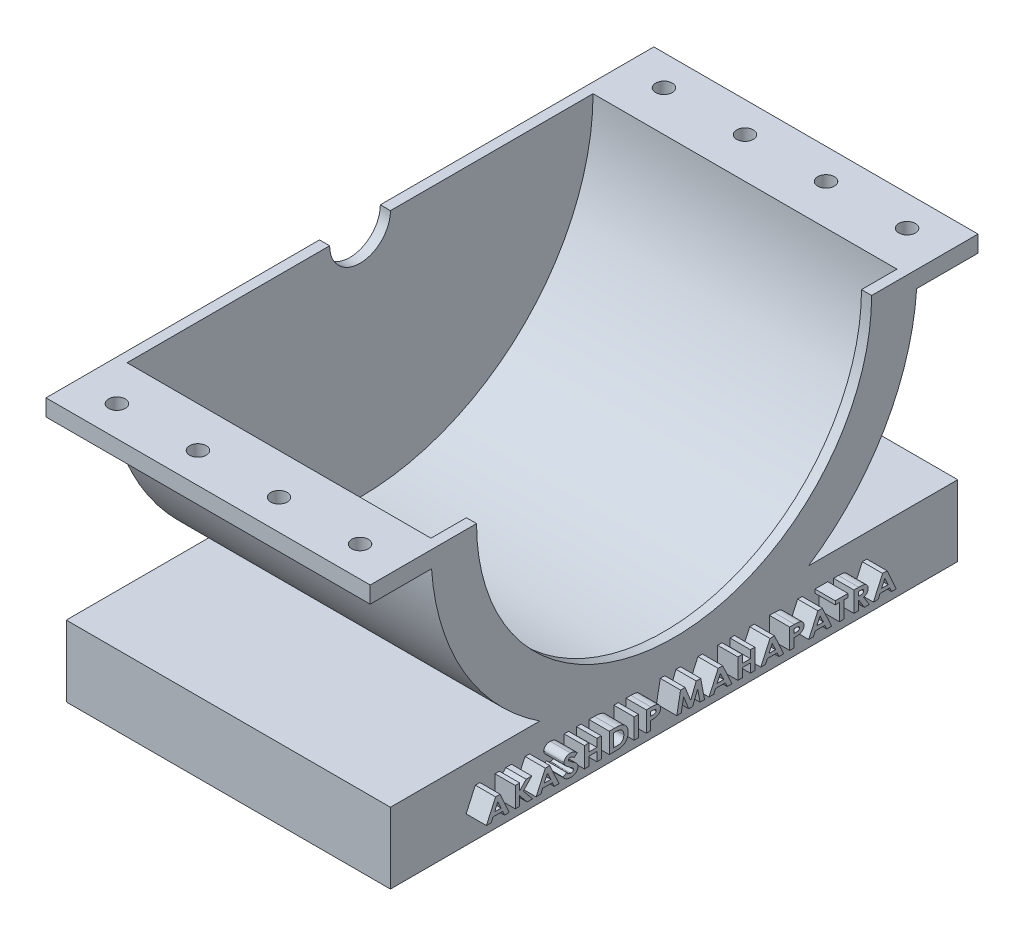
from build123d import *

# Parameters (mm, degrees)
BOSS_EXTRUDE1_DEPTH  = 4
SKETCH2_R            = 5.75
CUT_EXTRUDE1_DEPTH   = 3.75
SKETCH5_R            = 0.205
CUT_EXTRUDE2_DEPTH   = 0.41
LPATTERN1_COUNT      = 4
LPATTERN1_PITCH      = 2
LPATTERN1_COUNT_DIR2 = 2
LPATTERN1_PITCH_DIR2 = 13.5
CUT_EXTRUDE3_DEPTH   = 13.440483311
CUT_EXTRUDE4_REACH   = 14.44
SKETCH6_3_R          = 4.875
SKETCH6_3_R_2        = 0.75
SCALE1_SCALE         = 25.4
WRAP1_OUTLINE_W      = 2.767948718
WRAP1_OUTLINE_H      = 12.7
WRAP1_DEPTH          = 12.7


# Read off the part's stored shape, not the designer's step: Wrap1
with BuildPart() as part:
    # Sketch1 → Boss-Extrude1 (new, symmetric)
    with BuildSketch(Plane(origin=(0, 0, 0), x_dir=(0, 0, -1), z_dir=(1, 0, 0))):
        with BuildLine():
            Line((-7, 0.875), (-7, -0.875))
            Line((-7, -0.875), (7, -0.875))
            Line((7, -0.875), (7, 0.875))
            Line((7, 0.875), (3.31662479, 0.875))
            ThreePointArc((3.31662479, 0.875), (5.186676874, 2.858647401), (5.985975276, 5.465))
            Line((5.985975276, 5.465), (7.5, 5.465))
            Line((7.5, 5.465), (7.5, 5.875))
            Line((7.5, 5.875), (-7.5, 5.875))
            Line((-7.5, 5.875), (-7.5, 5.465))
            Line((-7.5, 5.465), (-5.985975276, 5.465))
            ThreePointArc((-5.985975276, 5.465), (-5.186676874, 2.858647401), (-3.31662479, 0.875))
            Line((-3.31662479, 0.875), (-7, 0.875))
        make_face()
    extrude(amount=BOSS_EXTRUDE1_DEPTH, both=True)

    # Sketch2 → Cut-Extrude1 (cut, symmetric)
    with BuildSketch(Plane(origin=(0, 0, 0), x_dir=(0, 0, -1), z_dir=(1, 0, 0))):
        with Locations((0, 5.875)):
            Circle(SKETCH2_R)
    extrude(amount=CUT_EXTRUDE1_DEPTH, both=True, mode=Mode.SUBTRACT)

    # Sketch5 → Cut-Extrude2 (cut)
    with BuildSketch(Plane(origin=(0, 5.875, 0), x_dir=(1, 0, 0), z_dir=(0, 1, 0))):
        with Locations(Location((-3, 6.75, 0), (0, 0, 270))):
            Circle(SKETCH5_R)
    cut_extrude2 = extrude(amount=-CUT_EXTRUDE2_DEPTH, mode=Mode.SUBTRACT)

    # LPattern1: Cut-Extrude2 4 × 2
    with Locations(*[(i * LPATTERN1_PITCH, 0, j * LPATTERN1_PITCH_DIR2) for i in range(LPATTERN1_COUNT) for j in range(LPATTERN1_COUNT_DIR2) if (i, j) != (0, 0)]):
        add(cut_extrude2, mode=Mode.SUBTRACT)

    # Sketch6 → Cut-Extrude3 (cut, through all)
    with BuildSketch(Plane(origin=(4, 0, 0), x_dir=(0, 0, -1), z_dir=(1, 0, 0))):
        with BuildLine():
            Line((-0.75, 5.875), (0.75, 5.875))
            ThreePointArc((0.75, 5.875), (0, 6.625), (-0.75, 5.875))
        make_face()
        with BuildLine():
            ThreePointArc((-0.75, 5.875), (0, 5.125), (0.75, 5.875))
            Line((0.75, 5.875), (-0.75, 5.875))
        make_face()
    extrude(amount=-CUT_EXTRUDE3_DEPTH, mode=Mode.SUBTRACT)

    # Sketch6<3> → Cut-Extrude4 (cut, up to next)
    with BuildSketch(Plane(origin=(4, 0, 0), x_dir=(0, 0, -1), z_dir=(1, 0, 0)), mode=Mode.PRIVATE) as cut_extrude4_sk1:
        with Locations((0, 5.875)):
            Circle(SKETCH6_3_R)
        with Locations((0, 5.875)):
            Circle(SKETCH6_3_R_2, mode=Mode.SUBTRACT)
    cut_extrude4_tool1 = extrude(cut_extrude4_sk1.sketch, amount=-CUT_EXTRUDE4_REACH, mode=Mode.PRIVATE) & part.part
    add(cut_extrude4_tool1.solids().sort_by_distance((4, 5.875, 4.737114))[0], mode=Mode.SUBTRACT)


with BuildPart() as part_1:
    # Scale1: scaled about (-0.158509588, 0.753010739, 0)
    add(part.part.scale(SCALE1_SCALE).moved(Location((3.867633947, -18.373462032, 0))))

    # Wrap1 outline → Wrap1 (add)
    # profile 1 of 17: a face of its own
    with BuildSketch(Plane(origin=(105.467633957, 0, 0), x_dir=(0, 0, -1), z_dir=(1, 0, 0))):
        with BuildLine():
            add(Edge.make_bspline(
                [(-75.386269734, -14.026275972), (-75.477958966, -13.922997687), (-75.655322175, -13.723216671), (-75.938888284, -13.457776604), (-76.223804813, -13.232635163), (-76.509602736, -13.047676728), (-76.796542554, -12.902535229), (-77.086206781, -12.799967333), (-77.378004048, -12.735753275), (-77.573858995, -12.727699864), (-77.670845054, -12.723711869)],
                knots=[0, 0, 0, 0, 0.152659398, 0.295303603, 0.428877079, 0.553739135, 0.671167669, 0.783579981, 0.892830255, 1, 1, 1, 1], degree=3))
            Line((-75.386269734, -14.026275972), (-73.256882714, -12.466760747))
            add(Edge.make_bspline(
                [(-77.597067009, -10.44422469), (-77.411895376, -10.449701146), (-77.044001247, -10.460581624), (-76.500185136, -10.544909617), (-75.969612247, -10.679463744), (-75.539167174, -10.839899429), (-75.19725817, -10.99820228), (-74.934878823, -11.141306106), (-74.668254416, -11.308586959), (-74.392257774, -11.492408138), (-74.116455115, -11.70569349), (-73.833006009, -11.938011206), (-73.542963935, -12.190946019), (-73.353627995, -12.373487329), (-73.256882714, -12.466760747)],
                knots=[0, 0, 0, 0, 0.112750237, 0.224009204, 0.33438332, 0.445685447, 0.503228736, 0.563788081, 0.627576777, 0.694912236, 0.765680889, 0.839822751, 0.918153981, 1, 1, 1, 1], degree=3))
            add(Edge.make_bspline(
                [(-81.723549381, -13.665017959), (-81.720427531, -13.556220905), (-81.714262719, -13.341375997), (-81.65593126, -13.025130729), (-81.561545953, -12.721251525), (-81.430545667, -12.429345087), (-81.263524687, -12.148462446), (-81.055779926, -11.882095815), (-80.812601987, -11.62684776), (-80.536423056, -11.387002357), (-80.232930968, -11.166675206), (-79.907514152, -10.973518281), (-79.564044442, -10.810086613), (-79.204397231, -10.674377148), (-78.82701403, -10.570590758), (-78.432237905, -10.496539819), (-78.020347233, -10.453415953), (-77.739635392, -10.447320472), (-77.597067009, -10.44422469)],
                knots=[0, 0, 0, 0, 0.056170461, 0.110921546, 0.165526908, 0.220249932, 0.275858717, 0.333966338, 0.394404589, 0.457760192, 0.522706535, 0.587934591, 0.653003504, 0.719006979, 0.786299609, 0.854964891, 0.926339335, 1, 1, 1, 1], degree=3))
            add(Edge.make_bspline(
                [(-77.777696016, -18.122229497), (-77.976611488, -17.985533848), (-78.357846721, -17.723547203), (-78.89827269, -17.336123962), (-79.38455412, -16.973660141), (-79.814568319, -16.633282062), (-80.189330383, -16.317404276), (-80.51177837, -16.02892824), (-80.777243778, -15.762563811), (-80.992840257, -15.515427718), (-81.165477966, -15.278350516), (-81.315657691, -15.048611128), (-81.439652642, -14.817461614), (-81.542524937, -14.586203797), (-81.625247558, -14.356275258), (-81.679886216, -14.124806472), (-81.71900626, -13.895315471), (-81.722040554, -13.741502629), (-81.723549381, -13.665017959)],
                knots=[0, 0, 0, 0, 0.11724404, 0.224706294, 0.32299845, 0.411847771, 0.491072557, 0.561070729, 0.621952114, 0.673650235, 0.720202811, 0.764310708, 0.806887658, 0.847460379, 0.88719842, 0.925365868, 0.962887579, 1, 1, 1, 1], degree=3))
            add(Edge.make_bspline(
                [(-75.699190407, -20.312674209), (-75.703354644, -20.239947544), (-75.711894351, -20.090805118), (-75.793163962, -19.87166074), (-75.914381887, -19.652691559), (-76.055369213, -19.474203428), (-76.199095043, -19.324225403), (-76.339889288, -19.195995695), (-76.507368941, -19.050130394), (-76.70699686, -18.893871689), (-76.933426716, -18.720873057), (-77.187600454, -18.531866628), (-77.473219247, -18.332108856), (-77.67330523, -18.194187273), (-77.777696016, -18.122229497)],
                knots=[0, 0, 0, 0, 0.069656103, 0.142845548, 0.221998529, 0.309697071, 0.360419396, 0.421544443, 0.492611602, 0.573810517, 0.665086112, 0.766465276, 0.878158015, 1, 1, 1, 1], degree=3))
            add(Edge.make_bspline(
                [(-77.446966849, -21.516019561), (-77.327849779, -21.512056206), (-77.097658433, -21.504397101), (-76.768556529, -21.43331912), (-76.466802636, -21.322335557), (-76.204509925, -21.162120013), (-75.982269072, -20.978749716), (-75.819616995, -20.772152702), (-75.715987542, -20.548050441), (-75.704770888, -20.390872815), (-75.699190407, -20.312674209)],
                knots=[0, 0, 0, 0, 0.152897008, 0.2954704, 0.430684796, 0.564139584, 0.688618973, 0.798927781, 0.899963069, 1, 1, 1, 1], degree=3))
            add(Edge.make_bspline(
                [(-79.957964445, -19.887814433), (-79.868001098, -20.016915275), (-79.694147228, -20.266402221), (-79.402283141, -20.596917403), (-79.10439283, -20.880492532), (-78.794541165, -21.113000666), (-78.472496733, -21.29238793), (-78.139925973, -21.422063803), (-77.79667879, -21.501307279), (-77.563550885, -21.511114904), (-77.446966849, -21.516019561)],
                knots=[0, 0, 0, 0, 0.151131279, 0.292060695, 0.42295247, 0.545866055, 0.663349338, 0.776115142, 0.888038283, 1, 1, 1, 1], degree=3))
            Line((-79.957964445, -19.887814433), (-82.374831432, -21.091159786))
            add(Edge.make_bspline(
                [(-77.541097458, -23.795506741), (-77.672601773, -23.793613133), (-77.931732427, -23.789881757), (-78.313961292, -23.758544787), (-78.683524228, -23.708127514), (-79.040443197, -23.636983029), (-79.384607654, -23.545306941), (-79.715612376, -23.434040554), (-80.032938756, -23.300111251), (-80.339264686, -23.148402384), (-80.632818733, -22.971207151), (-80.915767272, -22.773151354), (-81.185989811, -22.55005019), (-81.446969881, -22.305305632), (-81.694748026, -22.034879328), (-81.935552394, -21.743777797), (-82.164798787, -21.428921554), (-82.304130315, -21.204857037), (-82.374831432, -21.091159786)],
                knots=[0, 0, 0, 0, 0.067695667, 0.133395033, 0.197301531, 0.25963615, 0.320636965, 0.38055795, 0.43926413, 0.497840285, 0.556393655, 0.615625126, 0.675496782, 0.736652083, 0.799680074, 0.864190716, 0.931086178, 1, 1, 1, 1], degree=3))
            add(Edge.make_bspline(
                [(-72.931241689, -20.180382542), (-72.935296181, -20.308632126), (-72.943260735, -20.560562729), (-73.001962933, -20.930953613), (-73.105312303, -21.281596537), (-73.242456406, -21.618048141), (-73.426319009, -21.933667476), (-73.644557169, -22.236125135), (-73.908358125, -22.516974647), (-74.206354743, -22.779545658), (-74.53684736, -23.018193952), (-74.894139494, -23.227981909), (-75.276538291, -23.402680248), (-75.682653513, -23.546434794), (-76.112776384, -23.657089667), (-76.567564073, -23.738751719), (-77.046468246, -23.787688217), (-77.373921347, -23.792864215), (-77.541097458, -23.795506741)],
                knots=[0, 0, 0, 0, 0.058731266, 0.115370381, 0.171176354, 0.225851727, 0.281350033, 0.338062346, 0.396328134, 0.45742003, 0.519729533, 0.58274682, 0.646875847, 0.711984232, 0.779812749, 0.850056995, 0.92344892, 1, 1, 1, 1], degree=3))
            add(Edge.make_bspline(
                [(-74.551814605, -17.267421805), (-74.413346394, -17.388308652), (-74.149222622, -17.618896523), (-73.802479453, -17.980290884), (-73.517612167, -18.332597898), (-73.29604915, -18.683237142), (-73.133853867, -19.039460413), (-73.013510328, -19.40469594), (-72.944451288, -19.787673078), (-72.935672001, -20.04867337), (-72.931241689, -20.180382542)],
                knots=[0, 0, 0, 0, 0.159565823, 0.304366804, 0.434332212, 0.552441623, 0.663491149, 0.773416579, 0.885658692, 1, 1, 1, 1], degree=3))
            add(Edge.make_bspline(
                [(-76.566718452, -15.80203719), (-76.435311804, -15.894522925), (-76.185962607, -16.070018186), (-75.831165047, -16.318544551), (-75.519281632, -16.544206747), (-75.243905863, -16.73660319), (-75.015127473, -16.909952775), (-74.823424941, -17.05095058), (-74.673591696, -17.167568583), (-74.588172993, -17.237609119), (-74.551814605, -17.267421805)],
                knots=[0, 0, 0, 0, 0.193455233, 0.367088787, 0.521492782, 0.656907828, 0.771457166, 0.867016653, 0.943395768, 1, 1, 1, 1], degree=3))
            add(Edge.make_bspline(
                [(-78.696105471, -14.163655779), (-78.660168899, -14.200683976), (-78.576478324, -14.286916771), (-78.417522187, -14.419659867), (-78.218741161, -14.584958724), (-77.972812781, -14.774600526), (-77.686073754, -14.994680449), (-77.350881273, -15.236908084), (-76.975991323, -15.513396416), (-76.70786711, -15.702491725), (-76.566718452, -15.80203719)],
                knots=[0, 0, 0, 0, 0.057529563, 0.133977227, 0.230759984, 0.346009525, 0.480349956, 0.633995626, 0.807324277, 1, 1, 1, 1], degree=3))
            add(Edge.make_bspline(
                [(-78.955600663, -13.555622927), (-78.953086361, -13.608679827), (-78.947980848, -13.716416576), (-78.891570659, -13.871867187), (-78.813844932, -14.026920134), (-78.736458449, -14.116792217), (-78.696105471, -14.163655779)],
                knots=[0, 0, 0, 0, 0.234387218, 0.475944074, 0.726732412, 1, 1, 1, 1], degree=3))
            add(Edge.make_bspline(
                [(-77.670845054, -12.723711869), (-77.760966916, -12.726189334), (-77.934158817, -12.730950408), (-78.181525112, -12.779785926), (-78.403214249, -12.861409504), (-78.595658173, -12.972241661), (-78.751599082, -13.1022864), (-78.870769836, -13.24196979), (-78.940930979, -13.396201448), (-78.950784052, -13.503278836), (-78.955600663, -13.555622927)],
                knots=[0, 0, 0, 0, 0.160784811, 0.308988589, 0.447952035, 0.580944808, 0.70349073, 0.808979184, 0.906620706, 1, 1, 1, 1], degree=3))
        make_face()
    # profile 2 of 17: a face of its own
    with BuildSketch(Plane(origin=(105.467633957, 0, 0), x_dir=(0, 0, -1), z_dir=(1, 0, 0))):
        with BuildLine():
            add(Edge.make_bspline(
                [(-49.946582234, -10.769865715), (-49.682806834, -10.771430813), (-49.172840587, -10.774456672), (-48.433852577, -10.808558673), (-47.747323602, -10.860812724), (-47.112950483, -10.93297731), (-46.531049206, -11.028761459), (-46.001746173, -11.147515563), (-45.524346976, -11.285993773), (-45.093615202, -11.448079549), (-44.699733476, -11.637727781), (-44.326264267, -11.848541594), (-43.972571785, -12.088955749), (-43.635051934, -12.354074137), (-43.316146811, -12.64761111), (-43.016438367, -12.969945876), (-42.730642022, -13.315121772), (-42.466837532, -13.687003331), (-42.225276687, -14.078258623), (-42.016158325, -14.490486279), (-41.837688121, -14.917976139), (-41.691849806, -15.362783831), (-41.581031361, -15.824221481), (-41.49926562, -16.30085845), (-41.449651722, -16.794013624), (-41.444414194, -17.128230816), (-41.441754509, -17.297950651)],
                knots=[0, 0, 0, 0, 0.064682562, 0.125053069, 0.181373286, 0.233506669, 0.281576806, 0.32592416, 0.366460862, 0.403385688, 0.438640563, 0.473566974, 0.508463652, 0.543411727, 0.578735234, 0.614635613, 0.651275301, 0.688553917, 0.726361302, 0.763936324, 0.801786011, 0.839864113, 0.878602084, 0.918056892, 0.958388225, 1, 1, 1, 1], degree=3))
            Line((-49.946582234, -10.769865715), (-53.327651945, -10.769865715))
            Line((-53.327651945, -10.769865715), (-53.327651945, -23.469865715))
            Line((-53.327651945, -23.469865715), (-49.895700823, -23.469865715))
            add(Edge.make_bspline(
                [(-41.441754509, -17.297950651), (-41.44414517, -17.419248103), (-41.448864716, -17.65870858), (-41.473330769, -18.014806051), (-41.52087465, -18.362510743), (-41.579981039, -18.704583482), (-41.662466895, -19.038077534), (-41.762121029, -19.364919159), (-41.878186044, -19.68475147), (-42.058185167, -20.097010972), (-42.318649185, -20.586073046), (-42.689094021, -21.127665826), (-43.117562548, -21.61490819), (-43.597462129, -22.044353157), (-44.113597305, -22.417650012), (-44.65422723, -22.73271191), (-45.217095327, -22.983825249), (-45.711232885, -23.141850467), (-46.140936139, -23.240788632), (-46.518806719, -23.29847258), (-46.948775549, -23.352692369), (-47.433488605, -23.393760688), (-47.971943737, -23.430819176), (-48.56504313, -23.450865071), (-49.212098917, -23.467579334), (-49.661632458, -23.469082848), (-49.895700823, -23.469865715)],
                knots=[0, 0, 0, 0, 0.030361655, 0.05993874, 0.089264998, 0.118157205, 0.14677764, 0.175176881, 0.203645034, 0.231875647, 0.287706288, 0.342042914, 0.395730297, 0.449682155, 0.502876029, 0.554894698, 0.606009719, 0.656819361, 0.684467156, 0.716288442, 0.75243222, 0.792918197, 0.838010285, 0.88749821, 0.941421256, 1, 1, 1, 1], degree=3))
        make_face()
        with BuildLine():
            add(Edge.make_bspline(
                [(-49.196081432, -21.190378536), (-49.03406944, -21.190090188), (-48.720928322, -21.189532861), (-48.26901234, -21.165926662), (-47.851044597, -21.142080794), (-47.468733644, -21.096412915), (-47.119630077, -21.046875243), (-46.80657349, -20.97522992), (-46.524902055, -20.903223784), (-46.276674367, -20.808605428), (-46.050145598, -20.702747209), (-45.838987688, -20.579822898), (-45.636546327, -20.441386091), (-45.443741188, -20.288076336), (-45.265192007, -20.11439847), (-45.093383287, -19.929071145), (-44.933229254, -19.724484864), (-44.784089407, -19.504593341), (-44.647866021, -19.269952741), (-44.53216796, -19.020752519), (-44.431548488, -18.759271972), (-44.350810763, -18.484303032), (-44.287452697, -18.196113853), (-44.240875279, -17.894563368), (-44.216825194, -17.579886363), (-44.212100049, -17.365826856), (-44.209703227, -17.257245523)],
                knots=[0, 0, 0, 0, 0.066379239, 0.128299571, 0.185420288, 0.237881429, 0.286047228, 0.329809444, 0.36943239, 0.40506255, 0.43848559, 0.471805493, 0.505060091, 0.538926434, 0.572599663, 0.607033594, 0.642420576, 0.678951128, 0.71584845, 0.753470192, 0.791419537, 0.83056412, 0.870783025, 0.912264295, 0.955496208, 1, 1, 1, 1], degree=3))
            Line((-49.196081432, -21.190378536), (-50.559703227, -21.190378536))
            Line((-50.559703227, -21.190378536), (-50.559703227, -13.049352895))
            Line((-50.559703227, -13.049352895), (-49.562427586, -13.049352895))
            add(Edge.make_bspline(
                [(-45.583501304, -14.0669811), (-45.692595483, -13.984227943), (-45.916438818, -13.814432057), (-46.302233757, -13.610875276), (-46.7305958, -13.434949659), (-47.207559831, -13.294170755), (-47.729705326, -13.182532342), (-48.299588179, -13.10612979), (-48.915351729, -13.056567166), (-49.341837433, -13.051812262), (-49.562427586, -13.049352895)],
                knots=[0, 0, 0, 0, 0.098056154, 0.201195121, 0.311646586, 0.429778747, 0.557289561, 0.694211922, 0.841837983, 1, 1, 1, 1], degree=3))
            add(Edge.make_bspline(
                [(-44.209703227, -17.257245523), (-44.212907602, -17.090776709), (-44.219163696, -16.765769561), (-44.28841185, -16.293160146), (-44.393424736, -15.847488277), (-44.543873342, -15.430648721), (-44.737606596, -15.042912845), (-44.978445731, -14.68775479), (-45.254266133, -14.353970336), (-45.472946498, -14.163350025), (-45.583501304, -14.0669811)],
                knots=[0, 0, 0, 0, 0.138809677, 0.271006539, 0.397669159, 0.520335229, 0.639957083, 0.758301682, 0.877808367, 1, 1, 1, 1], degree=3))
        make_face(mode=Mode.SUBTRACT)
    # profile 3 of 17: a face of its own
    with BuildSketch(Plane(origin=(105.467633957, 0, 0), x_dir=(0, 0, -1), z_dir=(1, 0, 0))):
        with BuildLine():
            add(Edge.make_bspline(
                [(-27.099302586, -10.769865715), (-26.900853812, -10.770615759), (-26.51743688, -10.772064895), (-25.964288994, -10.789445001), (-25.453710526, -10.820603447), (-24.98675419, -10.859091107), (-24.562651605, -10.913434271), (-24.181741207, -10.974615287), (-23.843468121, -11.050719911), (-23.544017224, -11.139760777), (-23.274403952, -11.245456732), (-23.020582349, -11.357429717), (-22.785569572, -11.492863962), (-22.558785334, -11.632169848), (-22.353632105, -11.795718921), (-22.158444372, -11.967589361), (-21.980362014, -12.157835844), (-21.814572731, -12.359875302), (-21.668750415, -12.576511726), (-21.535688934, -12.800411274), (-21.430787956, -13.03903956), (-21.340181359, -13.285820994), (-21.272831986, -13.544239961), (-21.220036397, -13.812410422), (-21.193564214, -14.091885725), (-21.189126565, -14.281487554), (-21.186882714, -14.377357702)],
                knots=[0, 0, 0, 0, 0.075523183, 0.145916079, 0.210579531, 0.270187203, 0.324188515, 0.373266806, 0.416954459, 0.456058927, 0.492020561, 0.527117359, 0.561505119, 0.595168909, 0.628286806, 0.661199637, 0.694074469, 0.727341423, 0.760551971, 0.793377657, 0.826311052, 0.859592092, 0.893333146, 0.927829776, 0.963507894, 1, 1, 1, 1], degree=3))
            Line((-27.099302586, -10.769865715), (-30.142010919, -10.769865715))
            Line((-30.142010919, -10.769865715), (-30.142010919, -23.469865715))
            Line((-30.142010919, -23.469865715), (-27.374062202, -23.469865715))
            Line((-27.374062202, -23.469865715), (-27.374062202, -17.933968279))
            add(Edge.make_bspline(
                [(-24.300825022, -17.74061892), (-24.377825225, -17.756863842), (-24.546156123, -17.792377023), (-24.822752123, -17.827129112), (-25.142473293, -17.860594797), (-25.504700085, -17.888316444), (-25.911088114, -17.907621189), (-26.359742479, -17.922479354), (-26.852475048, -17.933414621), (-27.19512259, -17.933778337), (-27.374062202, -17.933968279)],
                knots=[0, 0, 0, 0, 0.076522491, 0.167286569, 0.270958151, 0.3892707, 0.52059945, 0.666694771, 0.825939192, 1, 1, 1, 1], degree=3))
            add(Edge.make_bspline(
                [(-21.186882714, -14.377357702), (-21.188938578, -14.483518891), (-21.192983947, -14.692414585), (-21.236348271, -14.99764111), (-21.298155166, -15.290492471), (-21.390576177, -15.569321072), (-21.510307203, -15.834312997), (-21.656845698, -16.085236681), (-21.827277376, -16.322801358), (-22.025148901, -16.544224418), (-22.242893307, -16.751868174), (-22.480590224, -16.944195042), (-22.738941635, -17.116460635), (-23.014335333, -17.274540574), (-23.308351068, -17.417539263), (-23.621045256, -17.544234492), (-23.953095031, -17.654964673), (-24.183352389, -17.71168259), (-24.300825022, -17.74061892)],
                knots=[0, 0, 0, 0, 0.063801037, 0.125542696, 0.185064361, 0.243607882, 0.301812767, 0.359632066, 0.418088887, 0.477341196, 0.53794333, 0.598875047, 0.660971661, 0.72448259, 0.789716812, 0.857431738, 0.927264565, 1, 1, 1, 1], degree=3))
        make_face()
        with BuildLine():
            add(Edge.make_bspline(
                [(-26.432756112, -15.6544811), (-26.343712082, -15.653786863), (-26.172394579, -15.652451177), (-25.926400929, -15.648080626), (-25.701547036, -15.638358157), (-25.498102819, -15.622246276), (-25.315396654, -15.606181729), (-25.154402941, -15.582273459), (-25.013850696, -15.558327427), (-24.856895296, -15.518319521), (-24.684604622, -15.454025818), (-24.499295577, -15.358400494), (-24.339285034, -15.238453496), (-24.199931216, -15.101966011), (-24.090247708, -14.942823883), (-24.009659761, -14.767579173), (-23.96310136, -14.575639784), (-23.957635458, -14.442906325), (-23.954831432, -14.374813632)],
                knots=[0, 0, 0, 0, 0.08477322, 0.163100621, 0.234218787, 0.298986372, 0.357388014, 0.408766014, 0.453896987, 0.493058607, 0.56279319, 0.628519755, 0.690846266, 0.752499867, 0.81341431, 0.873748193, 0.935232415, 1, 1, 1, 1], degree=3))
            Line((-26.432756112, -15.6544811), (-27.374062202, -15.6544811))
            Line((-27.374062202, -15.6544811), (-27.374062202, -13.049352895))
            Line((-27.374062202, -13.049352895), (-26.537063003, -13.049352895))
            add(Edge.make_bspline(
                [(-24.654450823, -13.301215875), (-24.700710923, -13.280694898), (-24.800485191, -13.236435038), (-24.969232743, -13.188144186), (-25.163720719, -13.144732176), (-25.385570302, -13.109944672), (-25.635156749, -13.082631751), (-25.911756138, -13.061921004), (-26.215612973, -13.053453066), (-26.42681855, -13.050759089), (-26.537063003, -13.049352895)],
                knots=[0, 0, 0, 0, 0.07932144, 0.171081311, 0.274702192, 0.391949426, 0.52316237, 0.668582642, 0.827007762, 1, 1, 1, 1], degree=3))
            add(Edge.make_bspline(
                [(-23.954831432, -14.374813632), (-23.956488649, -14.315297538), (-23.95971263, -14.19951383), (-23.993373506, -14.032058856), (-24.05064991, -13.877546496), (-24.126418894, -13.734563188), (-24.224970644, -13.603607434), (-24.349855195, -13.490599354), (-24.491433183, -13.384190494), (-24.599217989, -13.329328927), (-24.654450823, -13.301215875)],
                knots=[0, 0, 0, 0, 0.131107657, 0.255059259, 0.374558456, 0.493353329, 0.610786442, 0.733817826, 0.863598625, 1, 1, 1, 1], degree=3))
        make_face(mode=Mode.SUBTRACT)
    # profile 4 of 17: a face of its own
    with BuildSketch(Plane(origin=(105.467633957, 0, 0), x_dir=(0, 0, -1), z_dir=(1, 0, 0))):
        with BuildLine():
            add(Edge.make_bspline(
                [(62.810184593, -10.769865715), (63.008633368, -10.770615759), (63.3920503, -10.772064895), (63.945198185, -10.789445001), (64.455776653, -10.820603447), (64.922732989, -10.859091107), (65.346835574, -10.913434271), (65.727745973, -10.974615287), (66.066019058, -11.050719911), (66.365469955, -11.139760777), (66.635083227, -11.245456732), (66.88890483, -11.357429717), (67.123917608, -11.492863962), (67.350701845, -11.632169848), (67.555855075, -11.795718921), (67.751042807, -11.967589361), (67.929125166, -12.157835844), (68.094914448, -12.359875302), (68.240736765, -12.576511726), (68.373798245, -12.800411274), (68.478699224, -13.03903956), (68.56930582, -13.285820994), (68.636655194, -13.544239961), (68.689450783, -13.812410422), (68.715922965, -14.091885725), (68.720360615, -14.281487554), (68.722604465, -14.377357702)],
                knots=[0, 0, 0, 0, 0.075523183, 0.145916079, 0.210579531, 0.270187203, 0.324188515, 0.373266806, 0.416954459, 0.456058927, 0.492020561, 0.527117359, 0.561505119, 0.595168909, 0.628286806, 0.661199637, 0.694074469, 0.727341423, 0.760551971, 0.793377657, 0.826311052, 0.859592092, 0.893333146, 0.927829776, 0.963507894, 1, 1, 1, 1], degree=3))
            Line((62.810184593, -10.769865715), (59.76747626, -10.769865715))
            Line((59.76747626, -10.769865715), (59.76747626, -23.469865715))
            Line((59.76747626, -23.469865715), (62.535424978, -23.469865715))
            Line((62.535424978, -23.469865715), (62.535424978, -17.933968279))
            add(Edge.make_bspline(
                [(65.608662157, -17.74061892), (65.531661955, -17.756863842), (65.363331057, -17.792377023), (65.086735056, -17.827129112), (64.767013887, -17.860594797), (64.404787094, -17.888316444), (63.998399065, -17.907621189), (63.549744701, -17.922479354), (63.057012131, -17.933414621), (62.714364589, -17.933778337), (62.535424978, -17.933968279)],
                knots=[0, 0, 0, 0, 0.076522491, 0.167286569, 0.270958151, 0.3892707, 0.52059945, 0.666694771, 0.825939192, 1, 1, 1, 1], degree=3))
            add(Edge.make_bspline(
                [(68.722604465, -14.377357702), (68.720548601, -14.483518891), (68.716503232, -14.692414585), (68.673138909, -14.99764111), (68.611332014, -15.290492471), (68.518911003, -15.569321072), (68.399179976, -15.834312997), (68.252641481, -16.085236681), (68.082209803, -16.322801358), (67.884338278, -16.544224418), (67.666593873, -16.751868174), (67.428896956, -16.944195042), (67.170545544, -17.116460635), (66.895151847, -17.274540574), (66.601136112, -17.417539263), (66.288441923, -17.544234492), (65.956392148, -17.654964673), (65.726134791, -17.71168259), (65.608662157, -17.74061892)],
                knots=[0, 0, 0, 0, 0.063801037, 0.125542696, 0.185064361, 0.243607882, 0.301812767, 0.359632066, 0.418088887, 0.477341196, 0.53794333, 0.598875047, 0.660971661, 0.72448259, 0.789716812, 0.857431738, 0.927264565, 1, 1, 1, 1], degree=3))
        make_face()
        with BuildLine():
            add(Edge.make_bspline(
                [(63.476731068, -15.6544811), (63.565775097, -15.653786863), (63.737092601, -15.652451177), (63.98308625, -15.648080626), (64.207940144, -15.638358157), (64.411384361, -15.622246276), (64.594090526, -15.606181729), (64.755084238, -15.582273459), (64.895636483, -15.558327427), (65.052591883, -15.518319521), (65.224882557, -15.454025818), (65.410191603, -15.358400494), (65.570202145, -15.238453496), (65.709555964, -15.101966011), (65.819239472, -14.942823883), (65.899827419, -14.767579173), (65.94638582, -14.575639784), (65.951851722, -14.442906325), (65.954655747, -14.374813632)],
                knots=[0, 0, 0, 0, 0.08477322, 0.163100621, 0.234218787, 0.298986372, 0.357388014, 0.408766014, 0.453896987, 0.493058607, 0.56279319, 0.628519755, 0.690846266, 0.752499867, 0.81341431, 0.873748193, 0.935232415, 1, 1, 1, 1], degree=3))
            Line((63.476731068, -15.6544811), (62.535424978, -15.6544811))
            Line((62.535424978, -15.6544811), (62.535424978, -13.049352895))
            Line((62.535424978, -13.049352895), (63.372424177, -13.049352895))
            add(Edge.make_bspline(
                [(65.255036356, -13.301215875), (65.208776256, -13.280694898), (65.109001988, -13.236435038), (64.940254437, -13.188144186), (64.74576646, -13.144732176), (64.523916877, -13.109944672), (64.27433043, -13.082631751), (63.997731041, -13.061921004), (63.693874206, -13.053453066), (63.48266863, -13.050759089), (63.372424177, -13.049352895)],
                knots=[0, 0, 0, 0, 0.07932144, 0.171081311, 0.274702192, 0.391949426, 0.52316237, 0.668582642, 0.827007762, 1, 1, 1, 1], degree=3))
            add(Edge.make_bspline(
                [(65.954655747, -14.374813632), (65.95299853, -14.315297538), (65.94977455, -14.19951383), (65.916113674, -14.032058856), (65.85883727, -13.877546496), (65.783068286, -13.734563188), (65.684516535, -13.603607434), (65.559631985, -13.490599354), (65.418053997, -13.384190494), (65.31026919, -13.329328927), (65.255036356, -13.301215875)],
                knots=[0, 0, 0, 0, 0.131107657, 0.255059259, 0.374558456, 0.493353329, 0.610786442, 0.733817826, 0.863598625, 1, 1, 1, 1], degree=3))
        make_face(mode=Mode.SUBTRACT)
    # profile 5 of 17: a face of its own
    with BuildSketch(Plane(origin=(105.467633957, 0, 0), x_dir=(0, 0, -1), z_dir=(1, 0, 0))):
        with BuildLine():
            add(Edge.make_bspline(
                [(103.043133311, -10.769865715), (103.244132752, -10.770491776), (103.630954092, -10.771696623), (104.1890525, -10.790597298), (104.702414456, -10.81694698), (105.170895938, -10.856952714), (105.593513999, -10.910009336), (105.971269918, -10.973333815), (106.305169624, -11.044526304), (106.598863285, -11.13313462), (106.863237016, -11.233669648), (107.109168204, -11.349689712), (107.34309063, -11.478097191), (107.562894505, -11.624349932), (107.769651327, -11.784939453), (107.963507707, -11.961052664), (108.144630903, -12.15242598), (108.311971067, -12.35830975), (108.4645226, -12.574789957), (108.595382054, -12.804432122), (108.706685528, -13.042668243), (108.800030916, -13.290505328), (108.86719541, -13.549336107), (108.918567988, -13.816025424), (108.950012869, -14.093369554), (108.953682108, -14.281449196), (108.955553183, -14.377357702)],
                knots=[0, 0, 0, 0, 0.076523759, 0.147269181, 0.212586271, 0.272219192, 0.326243378, 0.374705614, 0.418026054, 0.456126503, 0.491384828, 0.52561704, 0.559580208, 0.592892562, 0.626024487, 0.659167423, 0.692512619, 0.726247885, 0.760104993, 0.79322433, 0.826734811, 0.860140914, 0.89389626, 0.928407503, 0.963492436, 1, 1, 1, 1], degree=3))
            Line((103.043133311, -10.769865715), (100.000424978, -10.769865715))
            Line((100.000424978, -10.769865715), (100.000424978, -23.469865715))
            Line((100.000424978, -23.469865715), (102.768373696, -23.469865715))
            Line((102.768373696, -23.469865715), (102.768373696, -17.933968279))
            Line((102.768373696, -17.933968279), (103.142352061, -17.933968279))
            Line((103.142352061, -17.933968279), (106.566670972, -23.469865715))
            Line((106.566670972, -23.469865715), (109.688245491, -23.469865715))
            Line((109.688245491, -23.469865715), (106.103650138, -17.674473087))
            add(Edge.make_bspline(
                [(108.955553183, -14.377357702), (108.953870874, -14.477521903), (108.950567846, -14.674183306), (108.916519847, -14.962686998), (108.861338181, -15.238747639), (108.780864818, -15.501954062), (108.683453104, -15.754409675), (108.559044908, -15.993008313), (108.414913895, -16.219146591), (108.246989238, -16.432065933), (108.059589657, -16.633844787), (107.84535805, -16.819400555), (107.612207361, -16.996065259), (107.352523966, -17.155434949), (107.073291879, -17.305476041), (106.770976479, -17.443584076), (106.446116996, -17.567699311), (106.219393413, -17.638386832), (106.103650138, -17.674473087)],
                knots=[0, 0, 0, 0, 0.063505384, 0.124685843, 0.18396903, 0.241824688, 0.299056927, 0.3553488, 0.412195564, 0.46889965, 0.527121683, 0.586575429, 0.64843074, 0.712457877, 0.779597179, 0.84939634, 0.923116243, 1, 1, 1, 1], degree=3))
        make_face()
        with BuildLine():
            add(Edge.make_bspline(
                [(103.699503504, -15.6544811), (103.813142927, -15.653260218), (104.031167686, -15.650917875), (104.345318494, -15.639979916), (104.631244232, -15.61402933), (104.889969743, -15.580617888), (105.121290164, -15.543236123), (105.323709031, -15.487872151), (105.500306284, -15.429140132), (105.650719625, -15.357186284), (105.778571856, -15.273709001), (105.889390633, -15.179829833), (105.981453821, -15.070775282), (106.059863898, -14.951450458), (106.114058466, -14.815659853), (106.158377046, -14.671425402), (106.184262854, -14.513105713), (106.186460735, -14.403740298), (106.187604465, -14.346828856)],
                knots=[0, 0, 0, 0, 0.10677273, 0.204850554, 0.295232061, 0.376364878, 0.449978777, 0.515105679, 0.573310074, 0.624622973, 0.671249972, 0.716445993, 0.760518514, 0.804942502, 0.849927358, 0.897317291, 0.946566096, 1, 1, 1, 1], degree=3))
            Line((103.699503504, -15.6544811), (102.768373696, -15.6544811))
            Line((102.768373696, -15.6544811), (102.768373696, -13.049352895))
            Line((102.768373696, -13.049352895), (103.58247626, -13.049352895))
            add(Edge.make_bspline(
                [(106.187604465, -14.346828856), (106.185268717, -14.279452979), (106.180673061, -14.14688886), (106.126485988, -13.95698929), (106.044827683, -13.7789662), (105.925764643, -13.620478873), (105.782706779, -13.476236149), (105.613712907, -13.354604086), (105.422867458, -13.254322959), (105.245591334, -13.190494599), (105.083455839, -13.150723389), (104.937444408, -13.123126655), (104.767454956, -13.101150561), (104.575830833, -13.080545509), (104.360287592, -13.065671687), (104.121907435, -13.055704037), (103.859794844, -13.05139026), (103.677455548, -13.050050675), (103.58247626, -13.049352895)],
                knots=[0, 0, 0, 0, 0.061578258, 0.121157123, 0.179568666, 0.240197836, 0.301751564, 0.365180649, 0.430194707, 0.498789664, 0.537245038, 0.583128135, 0.634900267, 0.694296343, 0.759750269, 0.832876305, 0.912946414, 1, 1, 1, 1], degree=3))
        make_face(mode=Mode.SUBTRACT)
    # profile 6 of 17: a face of its own
    with BuildSketch(Plane(origin=(105.467633957, 0, 0), x_dir=(0, 0, -1), z_dir=(1, 0, 0))):
        Polygon((-116.013549381, -23.469865715), (-121.758060599, -10.769865715), (-124.597243291, -10.769865715), (-130.341754509, -23.469865715), (-127.380456432, -23.469865715), (-126.22799249, -20.86473751), (-120.129855471, -20.86473751), (-118.974847458, -23.469865715), align=None)
        Polygon((-121.134763323, -18.585250331), (-125.215452426, -18.585250331), (-123.177651945, -14.176376132), align=None, mode=Mode.SUBTRACT)
    # profile 7 of 17: a face of its own
    with BuildSketch(Plane(origin=(105.467633957, 0, 0), x_dir=(0, 0, -1), z_dir=(1, 0, 0))):
        Polygon((-104.769266528, -23.469865715), (-101.408549381, -23.469865715), (-107.191221657, -16.387173408), (-101.922451625, -10.769865715), (-105.453621496, -10.769865715), (-109.468164766, -15.051536388), (-109.468164766, -10.769865715), (-112.236113484, -10.769865715), (-112.236113484, -23.469865715), (-109.468164766, -23.469865715), (-109.468164766, -17.712634145), align=None)
    # profile 8 of 17: a face of its own
    with BuildSketch(Plane(origin=(105.467633957, 0, 0), x_dir=(0, 0, -1), z_dir=(1, 0, 0))):
        Polygon((-87.811001304, -23.469865715), (-84.849703227, -23.469865715), (-90.594214445, -10.769865715), (-93.433397137, -10.769865715), (-99.177908355, -23.469865715), (-96.216610278, -23.469865715), (-95.064146336, -20.86473751), (-88.966009317, -20.86473751), align=None)
        Polygon((-89.970917169, -18.585250331), (-94.051606272, -18.585250331), (-92.013805791, -14.176376132), align=None, mode=Mode.SUBTRACT)
    # profile 9 of 17: a face of its own
    with BuildSketch(Plane(origin=(105.467633957, 0, 0), x_dir=(0, 0, -1), z_dir=(1, 0, 0))):
        Polygon((-61.094190407, -23.469865715), (-58.326241689, -23.469865715), (-58.326241689, -10.769865715), (-61.094190407, -10.769865715), (-61.094190407, -15.6544811), (-66.141626304, -15.6544811), (-66.141626304, -10.769865715), (-68.909575022, -10.769865715), (-68.909575022, -23.469865715), (-66.141626304, -23.469865715), (-66.141626304, -17.933968279), (-61.094190407, -17.933968279), align=None)
    # profile 10 of 17: a face of its own
    with BuildSketch(Plane(origin=(105.467633957, 0, 0), x_dir=(0, 0, -1), z_dir=(1, 0, 0))):
        with Locations((-36.361754509, -17.119865715)):
            Rectangle(WRAP1_OUTLINE_W, WRAP1_OUTLINE_H)
    # profile 11 of 17: a face of its own
    with BuildSketch(Plane(origin=(105.467633957, 0, 0), x_dir=(0, 0, -1), z_dir=(1, 0, 0))):
        Polygon((3.588802382, -23.469865715), (6.394912157, -23.469865715), (4.006029946, -10.769865715), (1.174479465, -10.769865715), (-2.315985278, -19.628319241), (-5.79627374, -10.769865715), (-8.643088644, -10.769865715), (-11.026882714, -23.469865715), (-8.218228868, -23.469865715), (-6.712139125, -15.448411388), (-3.56257983, -23.469865715), (-1.08211108, -23.469865715), (2.080168568, -15.448411388), align=None)
    # profile 12 of 17: a face of its own
    with BuildSketch(Plane(origin=(105.467633957, 0, 0), x_dir=(0, 0, -1), z_dir=(1, 0, 0))):
        Polygon((20.562332029, -23.469865715), (23.523630106, -23.469865715), (17.779118888, -10.769865715), (14.939936196, -10.769865715), (9.195424978, -23.469865715), (12.156723055, -23.469865715), (13.309186997, -20.86473751), (19.407324016, -20.86473751), align=None)
        Polygon((18.402416164, -18.585250331), (14.321727061, -18.585250331), (16.359527542, -14.176376132), align=None, mode=Mode.SUBTRACT)
    # profile 13 of 17: a face of its own
    with BuildSketch(Plane(origin=(105.467633957, 0, 0), x_dir=(0, 0, -1), z_dir=(1, 0, 0))):
        Polygon((35.116450619, -23.469865715), (37.884399337, -23.469865715), (37.884399337, -10.769865715), (35.116450619, -10.769865715), (35.116450619, -15.6544811), (30.069014722, -15.6544811), (30.069014722, -10.769865715), (27.301066004, -10.769865715), (27.301066004, -23.469865715), (30.069014722, -23.469865715), (30.069014722, -17.933968279), (35.116450619, -17.933968279), align=None)
    # profile 14 of 17: a face of its own
    with BuildSketch(Plane(origin=(105.467633957, 0, 0), x_dir=(0, 0, -1), z_dir=(1, 0, 0))):
        Polygon((53.028742286, -23.469865715), (55.990040363, -23.469865715), (50.245529145, -10.769865715), (47.406346452, -10.769865715), (41.661835234, -23.469865715), (44.623133311, -23.469865715), (45.775597254, -20.86473751), (51.873734273, -20.86473751), align=None)
        Polygon((50.86882642, -18.585250331), (46.788137318, -18.585250331), (48.825937798, -14.176376132), align=None, mode=Mode.SUBTRACT)
    # profile 15 of 17: a face of its own
    with BuildSketch(Plane(origin=(105.467633957, 0, 0), x_dir=(0, 0, -1), z_dir=(1, 0, 0))):
        Polygon((83.05284485, -23.469865715), (86.014142927, -23.469865715), (80.269631709, -10.769865715), (77.430449016, -10.769865715), (71.685937798, -23.469865715), (74.647235875, -23.469865715), (75.799699818, -20.86473751), (81.897836837, -20.86473751), align=None)
        Polygon((80.892928984, -18.585250331), (76.812239882, -18.585250331), (78.850040363, -14.176376132), align=None, mode=Mode.SUBTRACT)
    # profile 16 of 17: a face of its own
    with BuildSketch(Plane(origin=(105.467633957, 0, 0), x_dir=(0, 0, -1), z_dir=(1, 0, 0))):
        Polygon((90.931322414, -23.469865715), (93.699271132, -23.469865715), (93.699271132, -13.049352895), (96.304399337, -13.049352895), (96.304399337, -10.769865715), (88.326194209, -10.769865715), (88.326194209, -13.049352895), (90.931322414, -13.049352895), align=None)
    # profile 17 of 17: a face of its own
    with BuildSketch(Plane(origin=(105.467633957, 0, 0), x_dir=(0, 0, -1), z_dir=(1, 0, 0))):
        Polygon((123.611434593, -23.469865715), (126.57273267, -23.469865715), (120.828221452, -10.769865715), (117.98903876, -10.769865715), (112.244527542, -23.469865715), (115.205825619, -23.469865715), (116.358289561, -20.86473751), (122.456426581, -20.86473751), align=None)
        Polygon((121.451518728, -18.585250331), (117.370829625, -18.585250331), (119.408630106, -14.176376132), align=None, mode=Mode.SUBTRACT)
    extrude(amount=WRAP1_DEPTH)


solid = part_1.part
